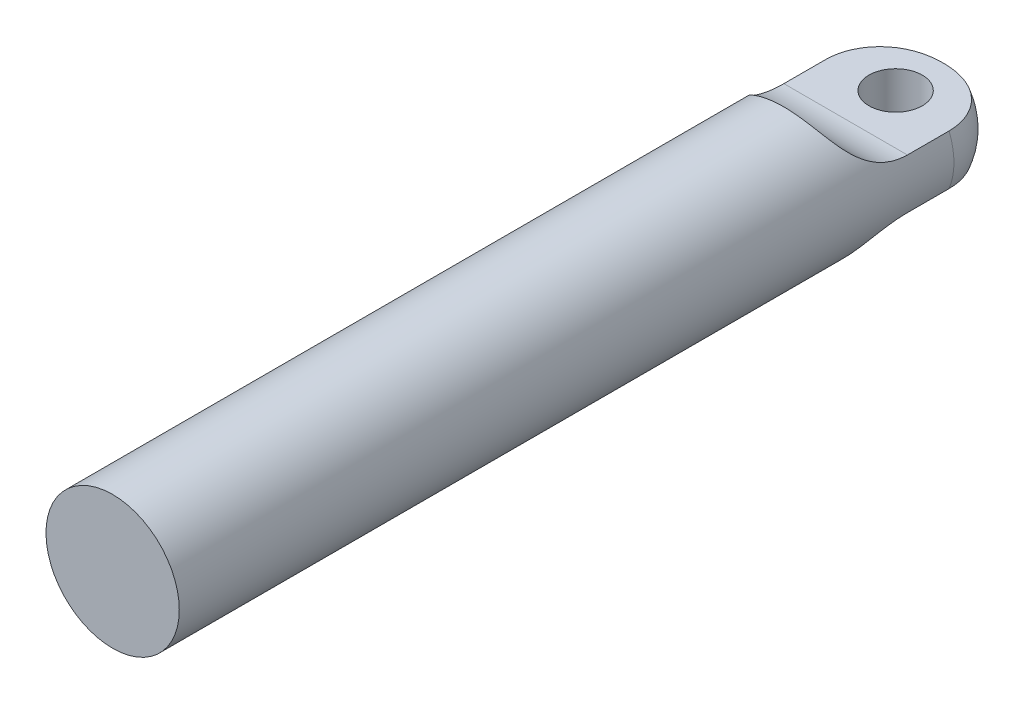
from build123d import *

# Parameters (mm, degrees)
SKETCH1_R               = 4
BOSS_EXTRUDE1_DEPTH     = 25
CUT_EXTRUDE1_DEPTH      = 26.632011236
CUT_EXTRUDE1_DEPTH_BACK = 26.632011236
SKETCH2_W               = 10
SKETCH2_H               = 2.5
FILLET1_R               = 4
M3_CLEARANCE_HOLE1_D    = 3.2
FILLET2_R               = 3.5


with BuildPart() as part:
    # Sketch1 → Boss-Extrude1 (new, symmetric)
    with BuildSketch(Plane.XY):
        Circle(SKETCH1_R)
    extrude(amount=BOSS_EXTRUDE1_DEPTH, both=True)

    # Sketch2 → Cut-Extrude1 (cut, two sides: drawn at the far end of the back side and taken through both)
    with BuildSketch(Plane(origin=(0, 0, 0), x_dir=(0, 0, -1), z_dir=(1, 0, 0)).offset(-CUT_EXTRUDE1_DEPTH_BACK)):
        with Locations((20, -2.75)):
            Rectangle(SKETCH2_W, SKETCH2_H)
        with Locations((20, 2.75)):
            Rectangle(SKETCH2_W, SKETCH2_H)
    extrude(amount=CUT_EXTRUDE1_DEPTH + CUT_EXTRUDE1_DEPTH_BACK, mode=Mode.SUBTRACT)

    # Fillet1
    # the kernel refuses this fillet: 4 mm, written as the material it adds along each edge
    with BuildSketch(Plane(origin=(13.708099244, -1.5, -15), x_dir=(0, -1, 0), z_dir=(-1, 0, 0))) as fillet1_piece_1_section:
        with BuildLine():
            CenterArc((FILLET1_R, -FILLET1_R), FILLET1_R, 90, 90)
            Line((0, -FILLET1_R), (0, 0))
            Line((0, 0), (FILLET1_R, 0))
        make_face()
    fillet1_piece_1 = extrude(amount=27.416198487, mode=Mode.PRIVATE)
    fillet1_piece_1 = fillet1_piece_1 & Plane(origin=(0, 0, -16.053491098), x_dir=(1, 0, 0), z_dir=(0, 0, 1)) * Cylinder(4, 71, mode=Mode.PRIVATE)
    add(fillet1_piece_1)
    with BuildSketch(Plane(origin=(-13.708099244, 1.5, -15), x_dir=(0, 1, 0), z_dir=(1, 0, 0))) as fillet1_piece_2_section:
        with BuildLine():
            CenterArc((FILLET1_R, -FILLET1_R), FILLET1_R, 90, 90)
            Line((0, -FILLET1_R), (0, 0))
            Line((0, 0), (FILLET1_R, 0))
        make_face()
    fillet1_piece_2 = extrude(amount=27.416198487, mode=Mode.PRIVATE)
    fillet1_piece_2 = fillet1_piece_2 & Plane(origin=(0, 0, -16.053491097), x_dir=(1, 0, 0), z_dir=(0, 0, 1)) * Cylinder(4, 71, mode=Mode.PRIVATE)
    add(fillet1_piece_2)

    # M3 Clearance Hole1 (through all)
    with Locations(Plane(origin=(0, 1.5, 0), x_dir=(1, 0, 0), z_dir=(0, 1, 0))):
        with Locations((0, 22)):
            Hole(M3_CLEARANCE_HOLE1_D / 2)

    # Fillet2
    # the kernel refuses this fillet: 3.5 mm, written as the material it takes off along each edge
    with BuildSketch(Plane(origin=(0, 0, -25), x_dir=(1, 0, 0), z_dir=(0, -1, 0))) as fillet2_piece_1:
        with BuildLine():
            CenterArc((4 - FILLET2_R, FILLET2_R), FILLET2_R, 270, 90)
            Line((4 - FILLET2_R, 0), (4, 0))
            Line((4, 0), (4, FILLET2_R))
        make_face()
    revolve(axis=Axis((0, 0, -25), (0, 0, 1)), revolution_arc=147.36184482, mode=Mode.SUBTRACT)
    with BuildSketch(Plane(origin=(0, 0, -25), x_dir=(0.842178541761355, 0.5391987609376692, 0), z_dir=(0.5391987609376692, -0.842178541761355, 0))) as fillet2_piece_2:
        with BuildLine():
            CenterArc((4 - FILLET2_R, FILLET2_R), FILLET2_R, 270, 90)
            Line((4 - FILLET2_R, 0), (4, 0))
            Line((4, 0), (4, FILLET2_R))
        make_face()
    revolve(axis=Axis((0, 0, -25), (0, 0, 1)), revolution_arc=294.74177665, mode=Mode.SUBTRACT)
    with BuildSketch(Plane(origin=(0, 0, -25), x_dir=(-0.8420934247140166, -0.5393316827828853, 0), z_dir=(-0.5393316827828853, 0.8420934247140166, 0))) as fillet2_piece_3:
        with BuildLine():
            CenterArc((4 - FILLET2_R, FILLET2_R), FILLET2_R, 270, 90)
            Line((4 - FILLET2_R, 0), (4, 0))
            Line((4, 0), (4, FILLET2_R))
        make_face()
    revolve(axis=Axis((0, 0, -25), (0, 0, 1)), revolution_arc=147.36184482, mode=Mode.SUBTRACT)


solid = part.part
